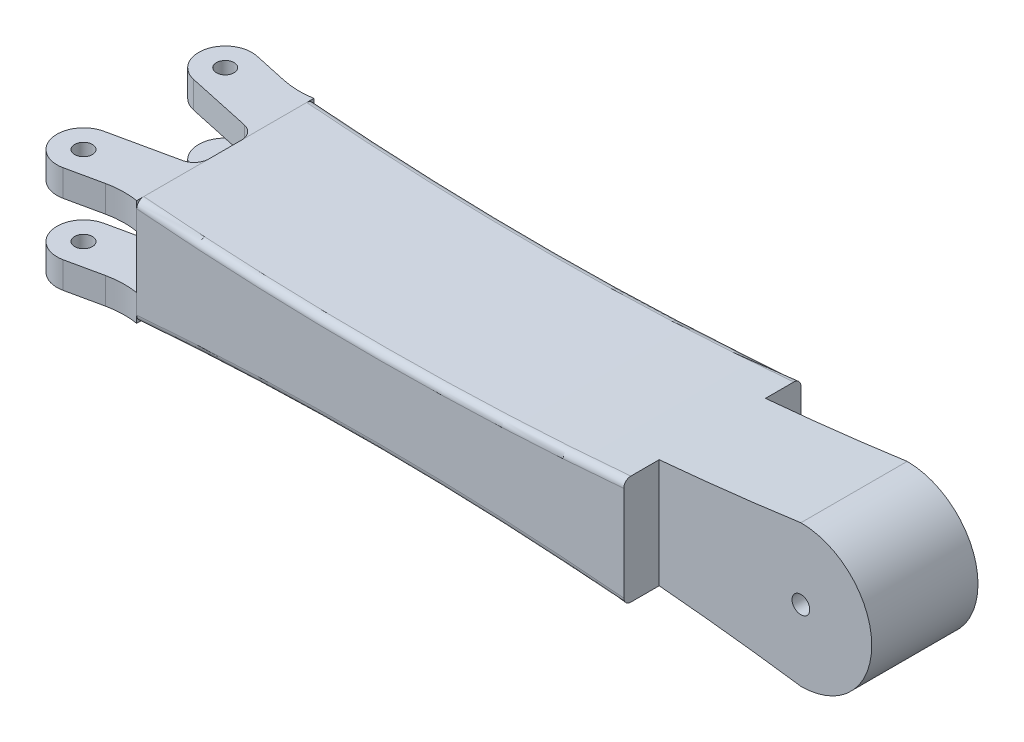
from build123d import *

# Parameters (mm, degrees)
SKETCH1_W               = 250
SKETCH1_H               = 50
BOSS_EXTRUDE1_DEPTH     = 55
CUT_EXTRUDE2_DEPTH      = 146.430395722
CUT_EXTRUDE2_DEPTH_BACK = 146.430395722
SKETCH4_OUTSIDE_W       = 304.164
SKETCH4_OUTSIDE_H       = 109.164
FILLET2_R               = 2
CUT_EXTRUDE3_DEPTH      = 143.762915509
CUT_EXTRUDE3_DEPTH_BACK = 143.762915509
SKETCH7_R               = 2.5
SKETCH12_W              = 86.46924187
SKETCH12_H              = 64.710234819
CUT_EXTRUDE7_DEPTH      = 10
CUT_EXTRUDE8_DEPTH      = 10
SKETCH14_R              = 2.5
BOSS_EXTRUDE2_DEPTH     = 30
SKETCH16_W              = 96.26246385
SKETCH16_H              = 15
CUT_EXTRUDE9_DEPTH      = 50
FILLET3_R               = 4.2
FILLET4_R               = 23


with BuildPart() as part:
    # Sketch1 → Boss-Extrude1 (new body)
    with BuildSketch(Plane(origin=(0, 0, 0), x_dir=(1, 0, 0), z_dir=(0, 1, 0))):
        Rectangle(SKETCH1_W, SKETCH1_H)
    extrude(amount=BOSS_EXTRUDE1_DEPTH)

    # Sketch4 outside → Cut-Extrude2 (cut, two sides: drawn at the far end of the back side and taken through both)
    with BuildSketch(Plane.XY.offset(25).offset(-CUT_EXTRUDE2_DEPTH_BACK)):
        with Locations((0, 27.5)):
            Rectangle(SKETCH4_OUTSIDE_W, SKETCH4_OUTSIDE_H)
        with BuildLine():
            Line((-72.5, 42.5), (-72.5, 12.5))
            ThreePointArc((-72.5, 12.5), (16.389156704, 14.940062989), (105, 7.5))
            ThreePointArc((105, 7.5), (125, 27.5), (105, 47.5))
            ThreePointArc((105, 47.5), (16.389156704, 40.059937011), (-72.5, 42.5))
        make_face(mode=Mode.SUBTRACT)
    extrude(amount=CUT_EXTRUDE2_DEPTH + CUT_EXTRUDE2_DEPTH_BACK, mode=Mode.SUBTRACT)

    # Fillet2
    fillet2_edges = [part.edges().sort_by_distance(p)[0] for p in [
        (16.389156704, 14.940062989, 25),
        (16.389156704, 40.059937011, 25),
        (16.389156704, 40.059937011, -25),
        (16.389156704, 14.940062989, -25),
    ]]
    fillet(fillet2_edges, radius=FILLET2_R)

    # Sketch7 → Cut-Extrude3 (cut, two sides: drawn at the far end of the back side and taken through both)
    with BuildSketch(Plane.XY.offset(25).offset(-CUT_EXTRUDE3_DEPTH_BACK)):
        with Locations((105, 27.5)):
            Circle(SKETCH7_R)
    extrude(amount=CUT_EXTRUDE3_DEPTH + CUT_EXTRUDE3_DEPTH_BACK, mode=Mode.SUBTRACT)

    # Sketch12 → Cut-Extrude7 (cut)
    with BuildSketch(Plane.XY.offset(25)):
        with Locations((108.234620935, 27.636294559)):
            Rectangle(SKETCH12_W, SKETCH12_H)
    extrude(amount=-CUT_EXTRUDE7_DEPTH, mode=Mode.SUBTRACT)

    # Sketch13 → Cut-Extrude8 (cut)
    with BuildSketch(Plane(origin=(0, 0, -25), x_dir=(-1, 0, 0), z_dir=(0, 0, -1))):
        with BuildLine():
            Line((-65, 42.911811435), (-65, 12.088188565))
            ThreePointArc((-65, 12.088188565), (-85.028868782, 10.045773403), (-105, 7.5))
            ThreePointArc((-105, 7.5), (-125, 27.5), (-105, 47.5))
            ThreePointArc((-105, 47.5), (-85.028868782, 44.954226597), (-65, 42.911811435))
        make_face()
    extrude(amount=-CUT_EXTRUDE8_DEPTH, mode=Mode.SUBTRACT)

    # Sketch14 → Boss-Extrude2 (add)
    # profile 1 of 2: a face of its own
    with BuildSketch(Plane(origin=(0, 42.5, 0), x_dir=(0, 0, 1), z_dir=(0, -1, 0))):
        with BuildLine():
            Line((-8.002367609, 72.5), (-12.669393759, 94.084995944))
            ThreePointArc((-12.669393759, 94.084995944), (-21.584995944, 99.830606241), (-27.330606241, 90.915004056))
            Line((-27.330606241, 90.915004056), (-23.348983742, 72.5))
            Line((-23.348983742, 72.5), (-8.002367609, 72.5))
        make_face()
        with Locations(Location((-20, 92.5, 0), (0, 0, 180))):
            Circle(SKETCH14_R, mode=Mode.SUBTRACT)
    # profile 2 of 2: a face of its own
    with BuildSketch(Plane(origin=(0, 42.5, 0), x_dir=(0, 0, 1), z_dir=(0, -1, 0))):
        with BuildLine():
            Line((27.330606241, 90.915004056), (23.348983742, 72.5))
            Line((23.348983742, 72.5), (8.002367609, 72.5))
            Line((8.002367609, 72.5), (12.669393759, 94.084995944))
            ThreePointArc((12.669393759, 94.084995944), (21.584995944, 99.830606241), (27.330606241, 90.915004056))
        make_face()
        with Locations((20, 92.5)):
            Circle(SKETCH14_R, mode=Mode.SUBTRACT)
    extrude(amount=BOSS_EXTRUDE2_DEPTH)

    # Sketch16 → Cut-Extrude9 (cut)
    with BuildSketch(Plane.ZY.offset(72.5)):
        with Locations((4.383084191, 27.5)):
            Rectangle(SKETCH16_W, SKETCH16_H)
    extrude(amount=CUT_EXTRUDE9_DEPTH, mode=Mode.SUBTRACT)

    # Fillet3
    fillet3_edges = [part.edges().sort_by_distance(p)[0] for p in [
        (-72.5, 16.25, -8.002367609),
        (-72.5, 16.25, 8.002367609),
        (-72.5, 38.75, 8.002367609),
        (-72.5, 38.75, -8.002367609),
    ]]
    fillet(fillet3_edges, radius=FILLET3_R)

    # Fillet4
    # the kernel refuses this fillet: 23 mm, written as the material it adds along each edge
    with BuildSketch(Plane(origin=(-72.5, 42.030514973, -23.348983742), x_dir=(0, 0, -1), z_dir=(0, -1, 0))) as fillet4_piece_1_section:
        with BuildLine():
            CenterArc((24.342833905, -3.752520734), FILLET4_R, 170.610040363, 21.590428365)
            Line((1.8623081, -8.613174962), (0, 0))
            Line((0, 0), (1.651016258, 0))
        make_face()
    fillet4_piece_1 = extrude(amount=51.530241063, mode=Mode.PRIVATE)
    fillet4_piece_1 = split(fillet4_piece_1, bisect_by=Plane(origin=(-72.5, 35, -23.348983742), z_dir=(0, 1, 0)), keep=Keep.TOP, mode=Mode.PRIVATE)
    add(fillet4_piece_1)
    with BuildSketch(Plane(origin=(-72.5, 20, -23.348983742), x_dir=(0, 0, -1), z_dir=(0, -1, 0))) as fillet4_piece_2_section:
        with BuildLine():
            CenterArc((24.342833905, -3.752520734), FILLET4_R, 170.610040363, 21.590428365)
            Line((1.8623081, -8.613174962), (0, 0))
            Line((0, 0), (1.651016258, 0))
        make_face()
    fillet4_piece_2 = extrude(amount=29.49972609, mode=Mode.PRIVATE)
    fillet4_piece_2 = split(fillet4_piece_2, bisect_by=Plane(origin=(-72.5, 12.5, -23.348983742), z_dir=(0, 1, 0)), keep=Keep.TOP, mode=Mode.PRIVATE)
    add(fillet4_piece_2)
    with BuildSketch(Plane(origin=(-72.5, 64.49972609, -23.348983742), x_dir=(0, 0, -1), z_dir=(0, -1, 0))) as fillet4_piece_3_section:
        with BuildLine():
            CenterArc((24.342833905, -3.752520734), FILLET4_R, 170.610040363, 21.590428365)
            Line((1.8623081, -8.613174962), (0, 0))
            Line((0, 0), (1.651016258, 0))
        make_face()
    fillet4_piece_3 = extrude(amount=29.49972609, mode=Mode.PRIVATE)
    fillet4_piece_3 = split(fillet4_piece_3, bisect_by=Plane(origin=(-72.5, 42.5, -23.348983742), z_dir=(0, -1, 0)), keep=Keep.TOP, mode=Mode.PRIVATE)
    add(fillet4_piece_3)
    with BuildSketch(Plane(origin=(-72.5, 64.49972609, -23.348983742), x_dir=(0, 0, -1), z_dir=(0, -1, 0))) as fillet4_piece_4_section:
        with BuildLine():
            CenterArc((24.342833905, -3.752520734), FILLET4_R, 170.610040363, 21.590428365)
            Line((1.8623081, -8.613174962), (0, 0))
            Line((0, 0), (1.651016258, 0))
        make_face()
    fillet4_piece_4 = extrude(amount=51.530241063, mode=Mode.PRIVATE)
    fillet4_piece_4 = split(fillet4_piece_4, bisect_by=Plane(origin=(-72.5, 20, -23.348983742), z_dir=(0, -1, 0)), keep=Keep.TOP, mode=Mode.PRIVATE)
    add(fillet4_piece_4)
    with BuildSketch(Plane(origin=(-72.5, 42.030514973, 23.348983742), x_dir=(0, 0, 1), z_dir=(0, -1, 0))) as fillet4_piece_5_section:
        with BuildLine():
            CenterArc((24.342833905, 3.752520734), FILLET4_R, 167.799531273, 21.590428365)
            Line((1.8623081, 8.613174962), (0, 0))
            Line((0, 0), (1.651016258, 0))
        make_face()
    fillet4_piece_5 = extrude(amount=51.530241063, mode=Mode.PRIVATE)
    fillet4_piece_5 = split(fillet4_piece_5, bisect_by=Plane(origin=(-72.5, 35, 23.348983742), z_dir=(0, 1, 0)), keep=Keep.TOP, mode=Mode.PRIVATE)
    add(fillet4_piece_5)
    with BuildSketch(Plane(origin=(-72.5, 20, 23.348983742), x_dir=(0, 0, 1), z_dir=(0, -1, 0))) as fillet4_piece_6_section:
        with BuildLine():
            CenterArc((24.342833905, 3.752520734), FILLET4_R, 167.799531273, 21.590428365)
            Line((1.8623081, 8.613174962), (0, 0))
            Line((0, 0), (1.651016258, 0))
        make_face()
    fillet4_piece_6 = extrude(amount=29.49972609, mode=Mode.PRIVATE)
    fillet4_piece_6 = split(fillet4_piece_6, bisect_by=Plane(origin=(-72.5, 12.5, 23.348983742), z_dir=(0, 1, 0)), keep=Keep.TOP, mode=Mode.PRIVATE)
    add(fillet4_piece_6)
    with BuildSketch(Plane(origin=(-72.5, 64.49972609, 23.348983742), x_dir=(0, 0, 1), z_dir=(0, -1, 0))) as fillet4_piece_7_section:
        with BuildLine():
            CenterArc((24.342833905, 3.752520734), FILLET4_R, 167.799531273, 21.590428365)
            Line((1.8623081, 8.613174962), (0, 0))
            Line((0, 0), (1.651016258, 0))
        make_face()
    fillet4_piece_7 = extrude(amount=29.49972609, mode=Mode.PRIVATE)
    fillet4_piece_7 = split(fillet4_piece_7, bisect_by=Plane(origin=(-72.5, 42.5, 23.348983742), z_dir=(0, -1, 0)), keep=Keep.TOP, mode=Mode.PRIVATE)
    add(fillet4_piece_7)
    with BuildSketch(Plane(origin=(-72.5, 64.49972609, 23.348983742), x_dir=(0, 0, 1), z_dir=(0, -1, 0))) as fillet4_piece_8_section:
        with BuildLine():
            CenterArc((24.342833905, 3.752520734), FILLET4_R, 167.799531273, 21.590428365)
            Line((1.8623081, 8.613174962), (0, 0))
            Line((0, 0), (1.651016258, 0))
        make_face()
    fillet4_piece_8 = extrude(amount=51.530241063, mode=Mode.PRIVATE)
    fillet4_piece_8 = split(fillet4_piece_8, bisect_by=Plane(origin=(-72.5, 20, 23.348983742), z_dir=(0, -1, 0)), keep=Keep.TOP, mode=Mode.PRIVATE)
    add(fillet4_piece_8)


solid = part.part
